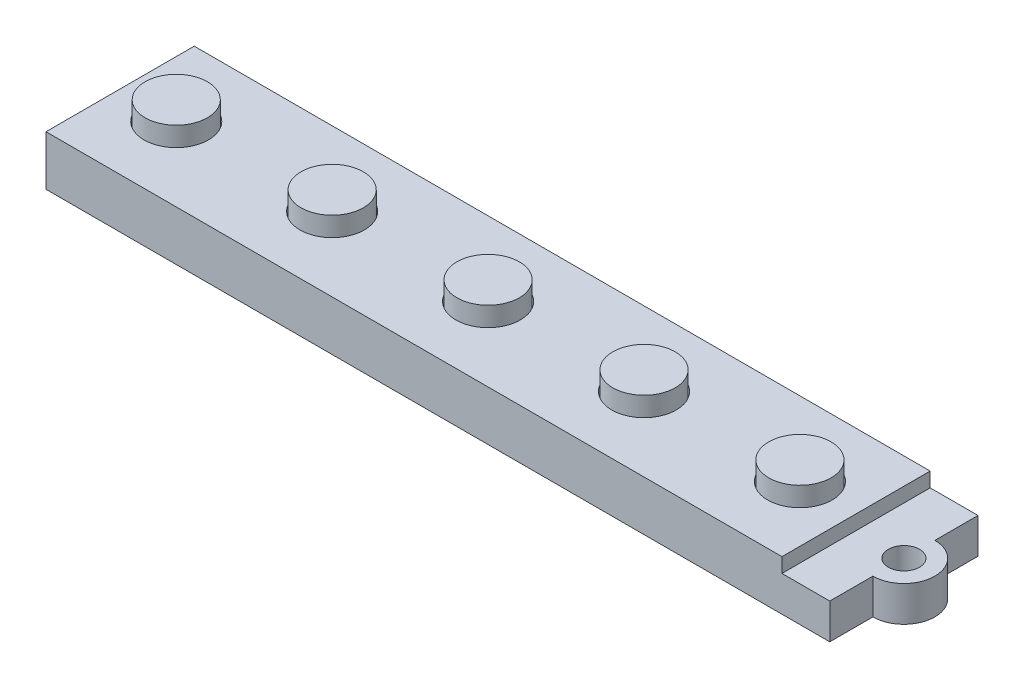
from build123d import *

# Parameters (mm, degrees)
SKETCH1_W           = 99.568
SKETCH1_H           = 18.1102
BOSS_EXTRUDE1_DEPTH = 6.096
SKETCH2_W           = 9.652
SKETCH2_H           = 18.1102
CUT_EXTRUDE1_DEPTH  = 1.778
SKETCH3_R           = 1.905
CUT_EXTRUDE2_DEPTH  = 122.383149472
SKETCH4_R           = 3.937
CUT_EXTRUDE3_DEPTH  = 1.27
SKETCH5_W           = 82.55
SKETCH5_H           = 12.7
BOSS_EXTRUDE2_DEPTH = 1.27
CUT_EXTRUDE4_DEPTH  = 122.434960352
SKETCH8_R           = 3.81
BOSS_EXTRUDE3_DEPTH = 3.556


with BuildPart() as part:
    # Sketch1 → Boss-Extrude1 (new body)
    with BuildSketch(Plane(origin=(0, 0, 0), x_dir=(1, 0, 0), z_dir=(0, 1, 0))):
        with Locations((-66.378666667, 25.894273737)):
            Rectangle(SKETCH1_W, SKETCH1_H)
    extrude(amount=BOSS_EXTRUDE1_DEPTH)

    # Sketch2 → Cut-Extrude1 (cut)
    with BuildSketch(Plane(origin=(0, 6.096, 0), x_dir=(1, 0, 0), z_dir=(0, 1, 0))):
        with Locations((-21.420666667, 25.894273737)):
            Rectangle(SKETCH2_W, SKETCH2_H)
    extrude(amount=-CUT_EXTRUDE1_DEPTH, mode=Mode.SUBTRACT)

    # Sketch3 → Cut-Extrude2 (cut, through all)
    with BuildSketch(Plane(origin=(0, 4.318, 0), x_dir=(1, 0, 0), z_dir=(0, 1, 0))):
        with Locations((-20.404666667, 25.894273737)):
            Circle(SKETCH3_R)
    extrude(amount=-CUT_EXTRUDE2_DEPTH, mode=Mode.SUBTRACT)

    # Sketch4 → Cut-Extrude3 (cut)
    with BuildSketch(Plane(origin=(0, 6.096, 0), x_dir=(1, 0, 0), z_dir=(0, 1, 0))):
        with Locations((-33.104666667, 25.894273737)):
            Circle(SKETCH4_R)
        with Locations((-52.154666667, 25.894273737)):
            Circle(SKETCH4_R)
        with Locations((-71.204666667, 25.894273737)):
            Circle(SKETCH4_R)
        with Locations((-90.254666667, 25.894273737)):
            Circle(SKETCH4_R)
        with Locations((-109.304666667, 25.894273737)):
            Circle(SKETCH4_R)
    extrude(amount=-CUT_EXTRUDE3_DEPTH, mode=Mode.SUBTRACT)

    # Sketch5 → Boss-Extrude2 (add)
    with BuildSketch(Plane.XZ):
        with Locations((-71.204666667, -25.894273737)):
            Rectangle(SKETCH5_W, SKETCH5_H)
    extrude(amount=BOSS_EXTRUDE2_DEPTH)

    # Sketch7 → Cut-Extrude4 (cut, through all)
    with BuildSketch(Plane(origin=(0, 4.318, 0), x_dir=(1, 0, 0), z_dir=(0, 1, 0))):
        with BuildLine():
            Line((-16.594666667, 34.949373737), (-20.404666667, 34.949373737))
            Line((-20.404666667, 34.949373737), (-20.404666667, 29.680045052))
            ThreePointArc((-20.404666667, 29.680045052), (-16.618895352, 25.894273737), (-20.404666667, 22.108502422))
            Line((-20.404666667, 22.108502422), (-20.404666667, 16.839173737))
            Line((-20.404666667, 16.839173737), (-16.594666667, 16.839173737))
            Line((-16.594666667, 16.839173737), (-16.594666667, 34.949373737))
        make_face()
    extrude(amount=-CUT_EXTRUDE4_DEPTH, mode=Mode.SUBTRACT)

    # Sketch8 → Boss-Extrude3 (add)
    with BuildSketch(Plane(origin=(0, 4.826, 0), x_dir=(1, 0, 0), z_dir=(0, 1, 0))):
        with Locations((-33.104666667, 25.894273737)):
            Circle(SKETCH8_R)
        with Locations((-52.154666667, 25.894273737)):
            Circle(SKETCH8_R)
        with Locations((-71.204666667, 25.894273737)):
            Circle(SKETCH8_R)
        with Locations((-90.254666667, 25.894273737)):
            Circle(SKETCH8_R)
        with Locations((-109.304666667, 25.894273737)):
            Circle(SKETCH8_R)
    extrude(amount=BOSS_EXTRUDE3_DEPTH)


solid = part.part
